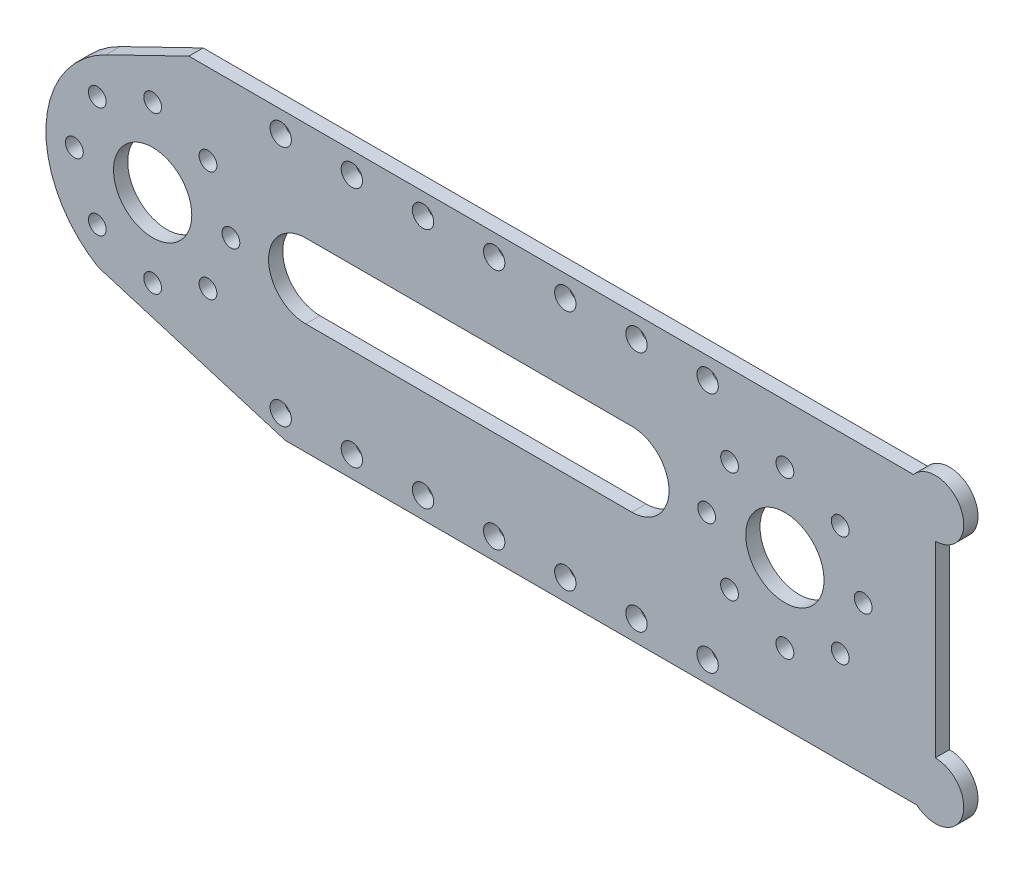
from build123d import *

# Parameters (mm, degrees)
RESSALTO_EXTRUS_O1_DEPTH      = 2.5
ESBO_O2_R                     = 5.5
CORTE_EXTRUS_O1_DEPTH         = 5
ESBO_O3_R                     = 1.25
CORTE_EXTRUS_O2_DEPTH         = 5
PADR_OCIRCULAR1_COUNT         = 8
ESPELHAR1_COPY_1_SKETCH_R     = 1.25
ESPELHAR1_COPY_1_DEPTH        = 5
ESPELHAR1_COPY_2_SKETCH_R     = 1.25
ESPELHAR1_COPY_2_DEPTH        = 5
ESPELHAR1_COPY_3_SKETCH_R     = 1.25
ESPELHAR1_COPY_3_DEPTH        = 5
ESPELHAR1_COPY_4_SKETCH_R     = 1.25
ESPELHAR1_COPY_4_DEPTH        = 5
ESPELHAR1_COPY_5_SKETCH_R     = 1.25
ESPELHAR1_COPY_5_DEPTH        = 5
ESPELHAR1_COPY_6_SKETCH_R     = 1.25
ESPELHAR1_COPY_6_DEPTH        = 5
ESPELHAR1_COPY_7_SKETCH_R     = 1.25
ESPELHAR1_COPY_7_DEPTH        = 5
CORTE_EXTRUS_O5_DEPTH         = 74.078475416
CORTE_EXTRUS_O5_DEPTH_BACK    = 74.078475416
CONVERTER_S_LIDO1_START       = -2.5
CONVERTER_S_LIDO1_OUTLINE_R   = 1.25
CONVERTER_S_LIDO1_OUTLINE_R_2 = 5.5
CONVERTER_S_LIDO1_DEPTH       = 3
ESBO_O8_R                     = 1.5
CORTE_EXTRUS_O3_DEPTH         = 2
PADR_O_LINEAR1_COUNT          = 7
PADR_O_LINEAR1_PITCH          = 10
CORTE_EXTRUS_O4_DEPTH         = 2


# Read off the part's stored shape, not the designer's step: Converter-Sólido1
with BuildPart() as part:
    # Esboço1 → Ressalto-extrusão1 (new, symmetric)
    with BuildSketch(Plane.XY):
        with BuildLine():
            Line((-59.430402553, 19.151096923), (62.502392295, 19.151096923))
            ThreePointArc((62.502392295, 19.151096923), (69.19383205, 18.276167196), (65.569597447, 12.583558694))
            Line((65.569597447, 12.583558694), (65.569597447, -13.806757673))
            ThreePointArc((65.569597447, -13.806757673), (69.322501763, -19.190849142), (62.972416023, -20.848903077))
            Line((62.972416023, -20.848903077), (-59.430402553, -20.848903077))
            Line((-59.430402553, -20.848903077), (-59.430402553, 19.151096923))
        make_face()
    extrude(amount=RESSALTO_EXTRUS_O1_DEPTH, both=True)

    # Esboço2 → Corte-extrusão1 (cut)
    with BuildSketch(Plane.XY.offset(2.5)):
        with Locations((-44.430402553, 0)):
            Circle(ESBO_O2_R)
    corte_extrus_o1 = extrude(amount=-CORTE_EXTRUS_O1_DEPTH, mode=Mode.SUBTRACT)

    # Esboço3 → Corte-extrusão2 (cut)
    with BuildSketch(Plane.XY.offset(2.5)):
        with Locations((-55.430402553, 0)):
            Circle(ESBO_O3_R)
    corte_extrus_o2 = extrude(amount=-CORTE_EXTRUS_O2_DEPTH, mode=Mode.SUBTRACT)

    # PadrãoCircular1: Corte-extrusão2 ×8 about axis
    padr_ocircular1_axis = Axis((-44.430402553, 0, 0), (0, 0, 1))
    for i in range(1, PADR_OCIRCULAR1_COUNT):
        add(corte_extrus_o2.rotate(padr_ocircular1_axis, i * 360 / PADR_OCIRCULAR1_COUNT), mode=Mode.SUBTRACT)

    # Espelhar1: Corte-extrusão1, Corte-extrusão2 across plane
    add(corte_extrus_o1.mirror(Plane(origin=(0, 0, 0), x_dir=(0, 0, 1), z_dir=(1, 0, 0))), mode=Mode.SUBTRACT)
    add(corte_extrus_o2.mirror(Plane(origin=(0, 0, 0), x_dir=(0, 0, 1), z_dir=(1, 0, 0))), mode=Mode.SUBTRACT)

    # Espelhar1 copy 1 sketch → Espelhar1 copy 1 (cut)
    with BuildSketch(Plane(origin=(13.013363617, 31.417038936, 2.5), x_dir=(-0.7071067811865476, 0.7071067811865475, 0), z_dir=(0, 0, 1))):
        with Locations((-55.430402553, 0)):
            Circle(ESPELHAR1_COPY_1_SKETCH_R)
    extrude(amount=-ESPELHAR1_COPY_1_DEPTH, mode=Mode.SUBTRACT)

    # Espelhar1 copy 2 sketch → Espelhar1 copy 2 (cut)
    with BuildSketch(Plane(origin=(44.430402553, 44.430402553, 2.5), x_dir=(0, 1, 0), z_dir=(0, 0, 1))):
        with Locations((-55.430402553, 0)):
            Circle(ESPELHAR1_COPY_2_SKETCH_R)
    extrude(amount=-ESPELHAR1_COPY_2_DEPTH, mode=Mode.SUBTRACT)

    # Espelhar1 copy 3 sketch → Espelhar1 copy 3 (cut)
    with BuildSketch(Plane(origin=(75.847441489, 31.417038936, 2.5), x_dir=(0.7071067811865475, 0.7071067811865476, 0), z_dir=(0, 0, 1))):
        with Locations((-55.430402553, 0)):
            Circle(ESPELHAR1_COPY_3_SKETCH_R)
    extrude(amount=-ESPELHAR1_COPY_3_DEPTH, mode=Mode.SUBTRACT)

    # Espelhar1 copy 4 sketch → Espelhar1 copy 4 (cut)
    with BuildSketch(Plane(origin=(88.860805106, 0, 2.5), x_dir=(1, 0, 0), z_dir=(0, 0, 1))):
        with Locations((-55.430402553, 0)):
            Circle(ESPELHAR1_COPY_4_SKETCH_R)
    extrude(amount=-ESPELHAR1_COPY_4_DEPTH, mode=Mode.SUBTRACT)

    # Espelhar1 copy 5 sketch → Espelhar1 copy 5 (cut)
    with BuildSketch(Plane(origin=(75.847441489, -31.417038936, 2.5), x_dir=(0.7071067811865477, -0.7071067811865475, 0), z_dir=(0, 0, 1))):
        with Locations((-55.430402553, 0)):
            Circle(ESPELHAR1_COPY_5_SKETCH_R)
    extrude(amount=-ESPELHAR1_COPY_5_DEPTH, mode=Mode.SUBTRACT)

    # Espelhar1 copy 6 sketch → Espelhar1 copy 6 (cut)
    with BuildSketch(Plane(origin=(44.430402553, -44.430402553, 2.5), x_dir=(0, -1, 0), z_dir=(0, 0, 1))):
        with Locations((-55.430402553, 0)):
            Circle(ESPELHAR1_COPY_6_SKETCH_R)
    extrude(amount=-ESPELHAR1_COPY_6_DEPTH, mode=Mode.SUBTRACT)

    # Espelhar1 copy 7 sketch → Espelhar1 copy 7 (cut)
    with BuildSketch(Plane(origin=(13.013363617, -31.417038936, 2.5), x_dir=(-0.7071067811865474, -0.7071067811865477, 0), z_dir=(0, 0, 1))):
        with Locations((-55.430402553, 0)):
            Circle(ESPELHAR1_COPY_7_SKETCH_R)
    extrude(amount=-ESPELHAR1_COPY_7_DEPTH, mode=Mode.SUBTRACT)

    # Esboço10 → Corte-extrusão5 (cut, two sides: drawn at the far end of the back side and taken through both)
    with BuildSketch(Plane(origin=(0, 0, -2.5), x_dir=(-1, 0, 0), z_dir=(0, 0, -1)).offset(-CORTE_EXTRUS_O5_DEPTH_BACK)):
        with BuildLine():
            Line((50.985622588, 13.491815678), (39.337809239, 19.151096923))
            Line((39.337809239, 19.151096923), (39.337809239, 27.419939303))
            Line((39.337809239, 27.419939303), (72.861321118, 27.419939303))
            Line((72.861321118, 27.419939303), (72.861321118, -27.215460657))
            Line((72.861321118, -27.215460657), (25.772247119, -27.215460657))
            Line((25.772247119, -27.215460657), (25.772247119, -20.848903077))
            Line((25.772247119, -20.848903077), (52.073972286, -12.906426373))
            ThreePointArc((52.073972286, -12.906426373), (59.417670602, 0.617896776), (50.985622588, 13.491815678))
        make_face()
    extrude(amount=CORTE_EXTRUS_O5_DEPTH + CORTE_EXTRUS_O5_DEPTH_BACK, mode=Mode.SUBTRACT)

    # Converter-Sólido1 outline → Converter-Sólido1 (cut)
    with BuildSketch(Plane.XY.offset(CONVERTER_S_LIDO1_START)):
        with BuildLine():
            Line((62.502392295, 19.151096923), (-39.337809239, 19.151096923))
            Line((-39.337809239, 19.151096923), (-50.985622588, 13.491815678))
            ThreePointArc((-50.985622588, 13.491815678), (-59.417670602, 0.617896776), (-52.073972286, -12.906426373))
            Line((-52.073972286, -12.906426373), (-25.772247119, -20.848903077))
            Line((-25.772247119, -20.848903077), (62.972416023, -20.848903077))
            ThreePointArc((62.972416023, -20.848903077), (69.322501763, -19.190849142), (65.569597447, -13.806757673))
            Line((65.569597447, -13.806757673), (65.569597447, 12.583558694))
            ThreePointArc((65.569597447, 12.583558694), (69.19383205, 18.276167196), (62.502392295, 19.151096923))
        make_face()
        with Locations((-44.430402553, -11)):
            Circle(CONVERTER_S_LIDO1_OUTLINE_R, mode=Mode.SUBTRACT)
        with Locations((-52.208577146, -7.778174593)):
            Circle(CONVERTER_S_LIDO1_OUTLINE_R, mode=Mode.SUBTRACT)
        with Locations((-36.65222796, -7.778174593)):
            Circle(CONVERTER_S_LIDO1_OUTLINE_R, mode=Mode.SUBTRACT)
        with Locations((36.65222796, -7.778174593)):
            Circle(CONVERTER_S_LIDO1_OUTLINE_R, mode=Mode.SUBTRACT)
        with Locations((44.430402553, -11)):
            Circle(CONVERTER_S_LIDO1_OUTLINE_R, mode=Mode.SUBTRACT)
        with Locations((52.208577146, -7.778174593)):
            Circle(CONVERTER_S_LIDO1_OUTLINE_R, mode=Mode.SUBTRACT)
        with Locations((-55.430402553, 0)):
            Circle(CONVERTER_S_LIDO1_OUTLINE_R, mode=Mode.SUBTRACT)
        with Locations((-44.430402553, 0)):
            Circle(CONVERTER_S_LIDO1_OUTLINE_R_2, mode=Mode.SUBTRACT)
        with Locations((-33.430402553, 0)):
            Circle(CONVERTER_S_LIDO1_OUTLINE_R, mode=Mode.SUBTRACT)
        with Locations((-52.208577146, 7.778174593)):
            Circle(CONVERTER_S_LIDO1_OUTLINE_R, mode=Mode.SUBTRACT)
        with Locations((-36.65222796, 7.778174593)):
            Circle(CONVERTER_S_LIDO1_OUTLINE_R, mode=Mode.SUBTRACT)
        with Locations((-44.430402553, 11)):
            Circle(CONVERTER_S_LIDO1_OUTLINE_R, mode=Mode.SUBTRACT)
        with Locations((33.430402553, 0)):
            Circle(CONVERTER_S_LIDO1_OUTLINE_R, mode=Mode.SUBTRACT)
        with Locations((36.65222796, 7.778174593)):
            Circle(CONVERTER_S_LIDO1_OUTLINE_R, mode=Mode.SUBTRACT)
        with Locations((44.430402553, 0)):
            Circle(CONVERTER_S_LIDO1_OUTLINE_R_2, mode=Mode.SUBTRACT)
        with Locations((55.430402553, 0)):
            Circle(CONVERTER_S_LIDO1_OUTLINE_R, mode=Mode.SUBTRACT)
        with Locations((52.208577146, 7.778174593)):
            Circle(CONVERTER_S_LIDO1_OUTLINE_R, mode=Mode.SUBTRACT)
        with Locations((44.430402553, 11)):
            Circle(CONVERTER_S_LIDO1_OUTLINE_R, mode=Mode.SUBTRACT)
    extrude(amount=CONVERTER_S_LIDO1_DEPTH, mode=Mode.SUBTRACT)

    # Esboço8 → Corte-extrusão3 (cut)
    with BuildSketch(Plane(origin=(0, 0, 0.5), x_dir=(-1, 0, 0), z_dir=(0, 0, -1))):
        with Locations((26.430402553, 16.151096923)):
            Circle(ESBO_O8_R)
        with Locations((26.430402553, -17.848903077)):
            Circle(ESBO_O8_R)
    corte_extrus_o3 = extrude(amount=-CORTE_EXTRUS_O3_DEPTH, mode=Mode.SUBTRACT)

    # Padrão linear1: Corte-extrusão3 ×7
    with Locations(*[(i * PADR_O_LINEAR1_PITCH, 0, 0) for i in range(1, PADR_O_LINEAR1_COUNT)]):
        add(corte_extrus_o3, mode=Mode.SUBTRACT)

    # Esboço9 → Corte-extrusão4 (cut)
    with BuildSketch(Plane(origin=(0, 0, 0.5), x_dir=(-1, 0, 0), z_dir=(0, 0, -1))):
        with BuildLine():
            Line((-22.912822242, 5.229141159), (22.912822242, 5.229141159))
            ThreePointArc((22.912822242, 5.229141159), (28.1419634, 0), (22.912822242, -5.229141159))
            Line((22.912822242, -5.229141159), (-22.912822242, -5.229141159))
            ThreePointArc((-22.912822242, -5.229141159), (-28.1419634, 0), (-22.912822242, 5.229141159))
        make_face()
    extrude(amount=-CORTE_EXTRUS_O4_DEPTH, mode=Mode.SUBTRACT)


solid = part.part
